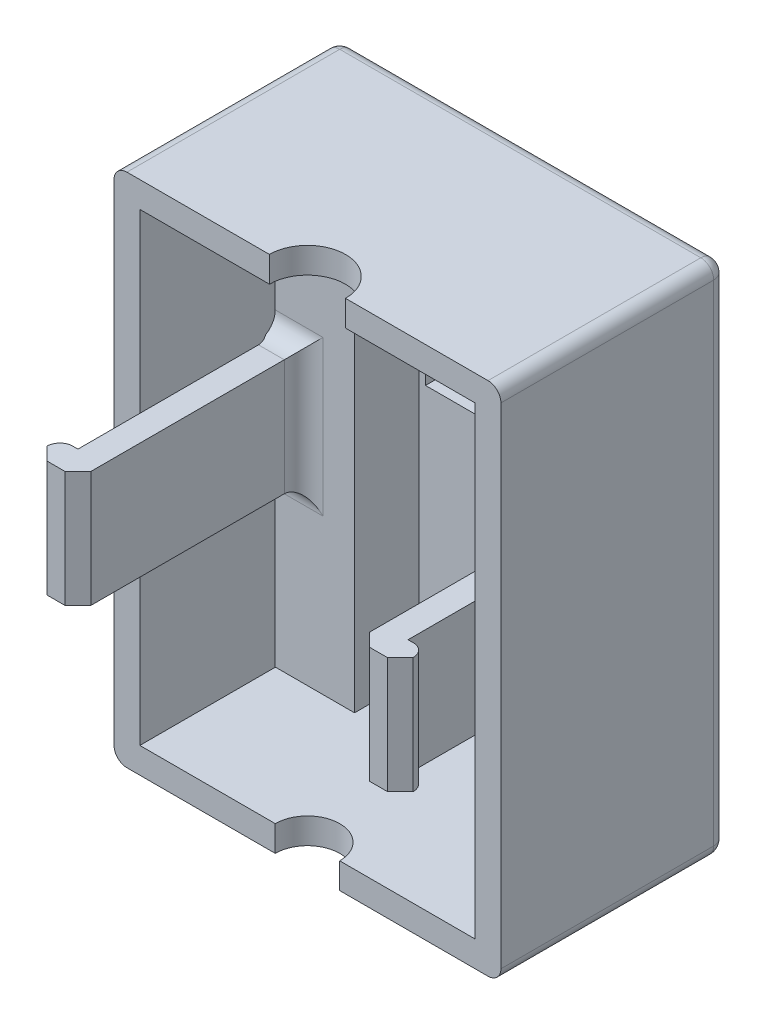
from build123d import *

# Parameters (mm, degrees)
SKETCH1_W           = 30
SKETCH1_H           = 40
BOSS_EXTRUDE1_DEPTH = 17.5
SKETCH2_W           = 26
SKETCH2_H           = 36
CUT_EXTRUDE1_DEPTH  = 15.5
SKETCH3_R           = 1.6
CUT_EXTRUDE2_DEPTH  = 30.41513216
BOSS_EXTRUDE2_DEPTH = 5
CUT_EXTRUDE3_DEPTH  = 45.443784717
CUT_EXTRUDE4_DEPTH  = 45.443784717
BOSS_EXTRUDE3_START = 0.2
SKETCH6_W           = 7
SKETCH6_H           = 9
SKETCH6_W_2         = 10.5
BOSS_EXTRUDE3_DEPTH = 2
FILLET2_R           = 1
BOSS_EXTRUDE7_START = 0.2
SKETCH7_W           = 17.5
SKETCH7_H           = 9
BOSS_EXTRUDE7_DEPTH = 2
SKETCH8_W           = 2
SKETCH8_H           = 9
BOSS_EXTRUDE8_DEPTH = 1.4
FILLET6_R           = 1.5
SKETCH9_W           = 2
SKETCH9_H           = 9
BOSS_EXTRUDE9_DEPTH = 1.4
CHAMFER1_SIZE       = 1
FILLET7_R           = 1


# Some blends are built 0.0001 mm under size
with BuildPart() as part:
    # Sketch1 → Boss-Extrude1 (new body)
    with BuildSketch(Plane.XY):
        Rectangle(SKETCH1_W, SKETCH1_H)
    extrude(amount=BOSS_EXTRUDE1_DEPTH)

    # Sketch2 → Cut-Extrude1 (cut)
    with BuildSketch(Plane.XY.offset(17.5)):
        Rectangle(SKETCH2_W, SKETCH2_H)
    extrude(amount=-CUT_EXTRUDE1_DEPTH, mode=Mode.SUBTRACT)

    # Sketch3 → Cut-Extrude2 (cut, through all)
    with BuildSketch(Plane.XY.offset(2)):
        Polygon((6.35, 1.75), (-6.35, 1.75), (-6.35, 15.75), (0, 15.75), (6.35, 15.75), align=None)
        with Locations((5.05, -6.6)):
            Circle(SKETCH3_R)
    extrude(amount=-CUT_EXTRUDE2_DEPTH, mode=Mode.SUBTRACT)

    # Sketch3<3> → Boss-Extrude2 (add)
    with BuildSketch(Plane.XY.offset(2)):
        Polygon((-6.85, -14), (-6.85, 18), (-13, 18), (-13, -17.985559901), (-6.85, -17.985559901), align=None)
        Polygon((13, 18), (6.85, 18), (6.85, -14), (6.85, -18), (13, -18), align=None)
    extrude(amount=BOSS_EXTRUDE2_DEPTH)

    # Sketch4 → Cut-Extrude3 (cut, through all)
    with BuildSketch(Plane.XZ.offset(-18)):
        with BuildLine():
            Line((-2.95, 17.5), (2.95, 17.5))
            ThreePointArc((2.95, 17.5), (0, 14.55), (-2.95, 17.5))
        make_face()
    extrude(amount=-CUT_EXTRUDE3_DEPTH, mode=Mode.SUBTRACT)

    # Sketch5 → Cut-Extrude4 (cut, through all)
    with BuildSketch(Plane(origin=(0, -18, 0), x_dir=(1, 0, 0), z_dir=(0, 1, 0))):
        with BuildLine():
            Line((-2.5, -17.5), (2.5, -17.5))
            ThreePointArc((2.5, -17.5), (0, -15), (-2.5, -17.5))
        make_face()
    extrude(amount=-CUT_EXTRUDE4_DEPTH, mode=Mode.SUBTRACT)

    # Sketch6 → Boss-Extrude3 (add)
    with BuildSketch(Plane.ZY.offset(-13).offset(BOSS_EXTRUDE3_START)):
        with Locations((21, 0)):
            Rectangle(SKETCH6_W, SKETCH6_H)
        with Locations((12.25, 0)):
            Rectangle(SKETCH6_W_2, SKETCH6_H)
    extrude(amount=BOSS_EXTRUDE3_DEPTH)

    # Fillet2
    fillet2_edges = [part.edges().sort_by_distance(p)[0] for p in [
        (0, -20, 0),
        (-15, 0, 0),
        (0, 20, 0),
        (15, 0, 0),
        (15, -20, 8.75),
        (-15, -20, 8.75),
        (-15, 20, 8.75),
        (15, 20, 8.75),
    ]]
    fillet(fillet2_edges, radius=FILLET2_R)

    # Sketch7 → Boss-Extrude7 (add)
    with BuildSketch(Plane(origin=(-13, 0, 0), x_dir=(0, 0, -1), z_dir=(1, 0, 0)).offset(BOSS_EXTRUDE7_START)):
        with Locations((-15.75, 0)):
            Rectangle(SKETCH7_W, SKETCH7_H)
    extrude(amount=BOSS_EXTRUDE7_DEPTH)

    # Sketch8 → Boss-Extrude8 (add)
    with BuildSketch(Plane.ZY.offset(12.8)):
        with Locations((23.5, 0)):
            Rectangle(SKETCH8_W, SKETCH8_H)
    extrude(amount=BOSS_EXTRUDE8_DEPTH)

    # Fillet6
    # the kernel refuses this fillet: 1.5 mm, written as the material it adds along each edge
    with BuildSketch(Plane(origin=(12.8, -4.5, 7), x_dir=(0, -1, 0), z_dir=(-1, 0, 0)), Plane(origin=(-12.8, 4.5, 7), x_dir=(0, 1, 0), z_dir=(1, 0, 0))) as fillet6_piece_1:
        with BuildLine():
            CenterArc((FILLET6_R, FILLET6_R), FILLET6_R, 180, 90)
            Line((0, FILLET6_R), (-FILLET6_R * 0.02, FILLET6_R))
            Line((-FILLET6_R * 0.02, FILLET6_R), (-FILLET6_R * 0.02, -FILLET6_R * 0.02))
            Line((-FILLET6_R * 0.02, -FILLET6_R * 0.02), (FILLET6_R, -FILLET6_R * 0.02))
            Line((FILLET6_R, -FILLET6_R * 0.02), (FILLET6_R, 0))
        make_face()
    extrude(amount=2)
    with BuildSketch(Plane(origin=(12.8, 4.5, 7), x_dir=(1, 0, 0), z_dir=(0, -1, 0)), Plane(origin=(-12.8, -4.5, 7), x_dir=(-1, 0, 0), z_dir=(0, 1, 0))) as fillet6_piece_2:
        with BuildLine():
            CenterArc((FILLET6_R, FILLET6_R), FILLET6_R, 180, 90)
            Line((0, FILLET6_R), (-FILLET6_R * 0.02, FILLET6_R))
            Line((-FILLET6_R * 0.02, FILLET6_R), (-FILLET6_R * 0.02, -FILLET6_R * 0.02))
            Line((-FILLET6_R * 0.02, -FILLET6_R * 0.02), (FILLET6_R, -FILLET6_R * 0.02))
            Line((FILLET6_R, -FILLET6_R * 0.02), (FILLET6_R, 0))
        make_face()
    extrude(amount=9)
    with BuildSketch(Plane(origin=(12.8, 4.5, 7), x_dir=(0, 1, 0), z_dir=(-1, 0, 0)), Plane(origin=(-12.8, -4.5, 7), x_dir=(0, -1, 0), z_dir=(1, 0, 0))) as fillet6_piece_3:
        with BuildLine():
            CenterArc((FILLET6_R, -FILLET6_R), FILLET6_R, 90, 90)
            Line((0, -FILLET6_R), (-FILLET6_R * 0.02, -FILLET6_R))
            Line((-FILLET6_R * 0.02, -FILLET6_R), (-FILLET6_R * 0.02, FILLET6_R * 0.02))
            Line((-FILLET6_R * 0.02, FILLET6_R * 0.02), (FILLET6_R, FILLET6_R * 0.02))
            Line((FILLET6_R, FILLET6_R * 0.02), (FILLET6_R, 0))
        make_face()
    extrude(amount=2)
    with BuildSketch(Plane(origin=(10.8, 4.5, 7), x_dir=(-1, 0, 0), z_dir=(0, -1, 0)), Plane(origin=(-10.8, -4.5, 7), x_dir=(1, 0, 0), z_dir=(0, 1, 0))) as fillet6_piece_4:
        with BuildLine():
            CenterArc((FILLET6_R, -FILLET6_R), FILLET6_R, 90, 90)
            Line((0, -FILLET6_R), (-FILLET6_R * 0.02, -FILLET6_R))
            Line((-FILLET6_R * 0.02, -FILLET6_R), (-FILLET6_R * 0.02, FILLET6_R * 0.02))
            Line((-FILLET6_R * 0.02, FILLET6_R * 0.02), (FILLET6_R, FILLET6_R * 0.02))
            Line((FILLET6_R, FILLET6_R * 0.02), (FILLET6_R, 0))
        make_face()
    extrude(amount=9)
    with BuildSketch(Plane(origin=(12.8, 4.5, 7), x_dir=(1, 0, 0), z_dir=(0, -1, 0))) as fillet6_piece_5a_section:
        with BuildLine():
            CenterArc((FILLET6_R, FILLET6_R), FILLET6_R, 180, 90)
            Line((0, FILLET6_R), (-FILLET6_R * 0.02, FILLET6_R))
            Line((-FILLET6_R * 0.02, FILLET6_R), (-FILLET6_R * 0.02, -FILLET6_R * 0.02))
            Line((-FILLET6_R * 0.02, -FILLET6_R * 0.02), (FILLET6_R, -FILLET6_R * 0.02))
            Line((FILLET6_R, -FILLET6_R * 0.02), (FILLET6_R, 0))
        make_face()
    fillet6_piece_5a = extrude(amount=12.75, mode=Mode.PRIVATE)
    fillet6_piece_5a = split(fillet6_piece_5a, bisect_by=Plane(origin=(13.139592671, -4.5, 7.339592671), z_dir=(0, -1, 0)), keep=Keep.TOP, mode=Mode.PRIVATE)
    with BuildSketch(Plane(origin=(16.55, -4.5, 7), x_dir=(0, -1, 0), z_dir=(-1, 0, 0))) as fillet6_piece_5b_section:
        with BuildLine():
            CenterArc((FILLET6_R, FILLET6_R), FILLET6_R, 180, 90)
            Line((0, FILLET6_R), (-FILLET6_R * 0.02, FILLET6_R))
            Line((-FILLET6_R * 0.02, FILLET6_R), (-FILLET6_R * 0.02, -FILLET6_R * 0.02))
            Line((-FILLET6_R * 0.02, -FILLET6_R * 0.02), (FILLET6_R, -FILLET6_R * 0.02))
            Line((FILLET6_R, -FILLET6_R * 0.02), (FILLET6_R, 0))
        make_face()
    fillet6_piece_5b = extrude(amount=5.75, mode=Mode.PRIVATE)
    fillet6_piece_5b = split(fillet6_piece_5b, bisect_by=Plane(origin=(12.8, -4.839592671, 7.339592671), z_dir=(1, 0, 0)), keep=Keep.TOP, mode=Mode.PRIVATE)
    fillet6_piece_5 = fillet6_piece_5a & fillet6_piece_5b
    add(fillet6_piece_5)
    with BuildSketch(Plane(origin=(10.8, 4.5, 7), x_dir=(-1, 0, 0), z_dir=(0, -1, 0))) as fillet6_piece_6a_section:
        with BuildLine():
            CenterArc((FILLET6_R, -FILLET6_R), FILLET6_R, 90, 90)
            Line((0, -FILLET6_R), (-FILLET6_R * 0.02, -FILLET6_R))
            Line((-FILLET6_R * 0.02, -FILLET6_R), (-FILLET6_R * 0.02, FILLET6_R * 0.02))
            Line((-FILLET6_R * 0.02, FILLET6_R * 0.02), (FILLET6_R, FILLET6_R * 0.02))
            Line((FILLET6_R, FILLET6_R * 0.02), (FILLET6_R, 0))
        make_face()
    fillet6_piece_6a = extrude(amount=12.75, mode=Mode.PRIVATE)
    fillet6_piece_6a = split(fillet6_piece_6a, bisect_by=Plane(origin=(10.460407329, -4.5, 7.339592671), z_dir=(0, -1, 0)), keep=Keep.TOP, mode=Mode.PRIVATE)
    with BuildSketch(Plane(origin=(12.8, -4.5, 7), x_dir=(0, -1, 0), z_dir=(-1, 0, 0))) as fillet6_piece_6b_section:
        with BuildLine():
            CenterArc((FILLET6_R, FILLET6_R), FILLET6_R, 180, 90)
            Line((0, FILLET6_R), (-FILLET6_R * 0.02, FILLET6_R))
            Line((-FILLET6_R * 0.02, FILLET6_R), (-FILLET6_R * 0.02, -FILLET6_R * 0.02))
            Line((-FILLET6_R * 0.02, -FILLET6_R * 0.02), (FILLET6_R, -FILLET6_R * 0.02))
            Line((FILLET6_R, -FILLET6_R * 0.02), (FILLET6_R, 0))
        make_face()
    fillet6_piece_6b = extrude(amount=5.75, mode=Mode.PRIVATE)
    fillet6_piece_6b = split(fillet6_piece_6b, bisect_by=Plane(origin=(10.8, -4.839592671, 7.339592671), z_dir=(-1, 0, 0)), keep=Keep.TOP, mode=Mode.PRIVATE)
    fillet6_piece_6 = fillet6_piece_6a & fillet6_piece_6b
    add(fillet6_piece_6)
    with BuildSketch(Plane(origin=(12.8, 8.25, 7), x_dir=(1, 0, 0), z_dir=(0, -1, 0))) as fillet6_piece_7a_section:
        with BuildLine():
            CenterArc((FILLET6_R, FILLET6_R), FILLET6_R, 180, 90)
            Line((0, FILLET6_R), (-FILLET6_R * 0.02, FILLET6_R))
            Line((-FILLET6_R * 0.02, FILLET6_R), (-FILLET6_R * 0.02, -FILLET6_R * 0.02))
            Line((-FILLET6_R * 0.02, -FILLET6_R * 0.02), (FILLET6_R, -FILLET6_R * 0.02))
            Line((FILLET6_R, -FILLET6_R * 0.02), (FILLET6_R, 0))
        make_face()
    fillet6_piece_7a = extrude(amount=12.75, mode=Mode.PRIVATE)
    fillet6_piece_7a = split(fillet6_piece_7a, bisect_by=Plane(origin=(13.139592671, 4.5, 7.339592671), z_dir=(0, 1, 0)), keep=Keep.TOP, mode=Mode.PRIVATE)
    with BuildSketch(Plane(origin=(16.55, 4.5, 7), x_dir=(0, 1, 0), z_dir=(-1, 0, 0))) as fillet6_piece_7b_section:
        with BuildLine():
            CenterArc((FILLET6_R, -FILLET6_R), FILLET6_R, 90, 90)
            Line((0, -FILLET6_R), (-FILLET6_R * 0.02, -FILLET6_R))
            Line((-FILLET6_R * 0.02, -FILLET6_R), (-FILLET6_R * 0.02, FILLET6_R * 0.02))
            Line((-FILLET6_R * 0.02, FILLET6_R * 0.02), (FILLET6_R, FILLET6_R * 0.02))
            Line((FILLET6_R, FILLET6_R * 0.02), (FILLET6_R, 0))
        make_face()
    fillet6_piece_7b = extrude(amount=5.75, mode=Mode.PRIVATE)
    fillet6_piece_7b = split(fillet6_piece_7b, bisect_by=Plane(origin=(12.8, 4.839592671, 7.339592671), z_dir=(1, 0, 0)), keep=Keep.TOP, mode=Mode.PRIVATE)
    fillet6_piece_7 = fillet6_piece_7a & fillet6_piece_7b
    add(fillet6_piece_7)
    with BuildSketch(Plane(origin=(12.8, 4.5, 7), x_dir=(0, 1, 0), z_dir=(-1, 0, 0))) as fillet6_piece_8a_section:
        with BuildLine():
            CenterArc((FILLET6_R, -FILLET6_R), FILLET6_R, 90, 90)
            Line((0, -FILLET6_R), (-FILLET6_R * 0.02, -FILLET6_R))
            Line((-FILLET6_R * 0.02, -FILLET6_R), (-FILLET6_R * 0.02, FILLET6_R * 0.02))
            Line((-FILLET6_R * 0.02, FILLET6_R * 0.02), (FILLET6_R, FILLET6_R * 0.02))
            Line((FILLET6_R, FILLET6_R * 0.02), (FILLET6_R, 0))
        make_face()
    fillet6_piece_8a = extrude(amount=5.75, mode=Mode.PRIVATE)
    fillet6_piece_8a = split(fillet6_piece_8a, bisect_by=Plane(origin=(10.8, 4.839592671, 7.339592671), z_dir=(-1, 0, 0)), keep=Keep.TOP, mode=Mode.PRIVATE)
    with BuildSketch(Plane(origin=(10.8, 8.25, 7), x_dir=(-1, 0, 0), z_dir=(0, -1, 0))) as fillet6_piece_8b_section:
        with BuildLine():
            CenterArc((FILLET6_R, -FILLET6_R), FILLET6_R, 90, 90)
            Line((0, -FILLET6_R), (-FILLET6_R * 0.02, -FILLET6_R))
            Line((-FILLET6_R * 0.02, -FILLET6_R), (-FILLET6_R * 0.02, FILLET6_R * 0.02))
            Line((-FILLET6_R * 0.02, FILLET6_R * 0.02), (FILLET6_R, FILLET6_R * 0.02))
            Line((FILLET6_R, FILLET6_R * 0.02), (FILLET6_R, 0))
        make_face()
    fillet6_piece_8b = extrude(amount=12.75, mode=Mode.PRIVATE)
    fillet6_piece_8b = split(fillet6_piece_8b, bisect_by=Plane(origin=(10.460407329, 4.5, 7.339592671), z_dir=(0, 1, 0)), keep=Keep.TOP, mode=Mode.PRIVATE)
    fillet6_piece_8 = fillet6_piece_8a & fillet6_piece_8b
    add(fillet6_piece_8)
    with BuildSketch(Plane(origin=(-16.55, 4.5, 7), x_dir=(0, 1, 0), z_dir=(1, 0, 0))) as fillet6_piece_9a_section:
        with BuildLine():
            CenterArc((FILLET6_R, FILLET6_R), FILLET6_R, 180, 90)
            Line((0, FILLET6_R), (-FILLET6_R * 0.02, FILLET6_R))
            Line((-FILLET6_R * 0.02, FILLET6_R), (-FILLET6_R * 0.02, -FILLET6_R * 0.02))
            Line((-FILLET6_R * 0.02, -FILLET6_R * 0.02), (FILLET6_R, -FILLET6_R * 0.02))
            Line((FILLET6_R, -FILLET6_R * 0.02), (FILLET6_R, 0))
        make_face()
    fillet6_piece_9a = extrude(amount=5.75, mode=Mode.PRIVATE)
    fillet6_piece_9a = split(fillet6_piece_9a, bisect_by=Plane(origin=(-12.8, 4.839592671, 7.339592671), z_dir=(-1, 0, 0)), keep=Keep.TOP, mode=Mode.PRIVATE)
    with BuildSketch(Plane(origin=(-12.8, -4.5, 7), x_dir=(-1, 0, 0), z_dir=(0, 1, 0))) as fillet6_piece_9b_section:
        with BuildLine():
            CenterArc((FILLET6_R, FILLET6_R), FILLET6_R, 180, 90)
            Line((0, FILLET6_R), (-FILLET6_R * 0.02, FILLET6_R))
            Line((-FILLET6_R * 0.02, FILLET6_R), (-FILLET6_R * 0.02, -FILLET6_R * 0.02))
            Line((-FILLET6_R * 0.02, -FILLET6_R * 0.02), (FILLET6_R, -FILLET6_R * 0.02))
            Line((FILLET6_R, -FILLET6_R * 0.02), (FILLET6_R, 0))
        make_face()
    fillet6_piece_9b = extrude(amount=12.75, mode=Mode.PRIVATE)
    fillet6_piece_9b = split(fillet6_piece_9b, bisect_by=Plane(origin=(-13.139592671, 4.5, 7.339592671), z_dir=(0, 1, 0)), keep=Keep.TOP, mode=Mode.PRIVATE)
    fillet6_piece_9 = fillet6_piece_9a & fillet6_piece_9b
    add(fillet6_piece_9)
    with BuildSketch(Plane(origin=(-10.8, -4.5, 7), x_dir=(1, 0, 0), z_dir=(0, 1, 0))) as fillet6_piece_10a_section:
        with BuildLine():
            CenterArc((FILLET6_R, -FILLET6_R), FILLET6_R, 90, 90)
            Line((0, -FILLET6_R), (-FILLET6_R * 0.02, -FILLET6_R))
            Line((-FILLET6_R * 0.02, -FILLET6_R), (-FILLET6_R * 0.02, FILLET6_R * 0.02))
            Line((-FILLET6_R * 0.02, FILLET6_R * 0.02), (FILLET6_R, FILLET6_R * 0.02))
            Line((FILLET6_R, FILLET6_R * 0.02), (FILLET6_R, 0))
        make_face()
    fillet6_piece_10a = extrude(amount=12.75, mode=Mode.PRIVATE)
    fillet6_piece_10a = split(fillet6_piece_10a, bisect_by=Plane(origin=(-10.460407329, 4.5, 7.339592671), z_dir=(0, 1, 0)), keep=Keep.TOP, mode=Mode.PRIVATE)
    with BuildSketch(Plane(origin=(-12.8, 4.5, 7), x_dir=(0, 1, 0), z_dir=(1, 0, 0))) as fillet6_piece_10b_section:
        with BuildLine():
            CenterArc((FILLET6_R, FILLET6_R), FILLET6_R, 180, 90)
            Line((0, FILLET6_R), (-FILLET6_R * 0.02, FILLET6_R))
            Line((-FILLET6_R * 0.02, FILLET6_R), (-FILLET6_R * 0.02, -FILLET6_R * 0.02))
            Line((-FILLET6_R * 0.02, -FILLET6_R * 0.02), (FILLET6_R, -FILLET6_R * 0.02))
            Line((FILLET6_R, -FILLET6_R * 0.02), (FILLET6_R, 0))
        make_face()
    fillet6_piece_10b = extrude(amount=5.75, mode=Mode.PRIVATE)
    fillet6_piece_10b = split(fillet6_piece_10b, bisect_by=Plane(origin=(-10.8, 4.839592671, 7.339592671), z_dir=(1, 0, 0)), keep=Keep.TOP, mode=Mode.PRIVATE)
    fillet6_piece_10 = fillet6_piece_10a & fillet6_piece_10b
    add(fillet6_piece_10)
    with BuildSketch(Plane(origin=(-16.55, -4.5, 7), x_dir=(0, -1, 0), z_dir=(1, 0, 0))) as fillet6_piece_11a_section:
        with BuildLine():
            CenterArc((FILLET6_R, -FILLET6_R), FILLET6_R, 90, 90)
            Line((0, -FILLET6_R), (-FILLET6_R * 0.02, -FILLET6_R))
            Line((-FILLET6_R * 0.02, -FILLET6_R), (-FILLET6_R * 0.02, FILLET6_R * 0.02))
            Line((-FILLET6_R * 0.02, FILLET6_R * 0.02), (FILLET6_R, FILLET6_R * 0.02))
            Line((FILLET6_R, FILLET6_R * 0.02), (FILLET6_R, 0))
        make_face()
    fillet6_piece_11a = extrude(amount=5.75, mode=Mode.PRIVATE)
    fillet6_piece_11a = split(fillet6_piece_11a, bisect_by=Plane(origin=(-12.8, -4.839592671, 7.339592671), z_dir=(-1, 0, 0)), keep=Keep.TOP, mode=Mode.PRIVATE)
    with BuildSketch(Plane(origin=(-12.8, -8.25, 7), x_dir=(-1, 0, 0), z_dir=(0, 1, 0))) as fillet6_piece_11b_section:
        with BuildLine():
            CenterArc((FILLET6_R, FILLET6_R), FILLET6_R, 180, 90)
            Line((0, FILLET6_R), (-FILLET6_R * 0.02, FILLET6_R))
            Line((-FILLET6_R * 0.02, FILLET6_R), (-FILLET6_R * 0.02, -FILLET6_R * 0.02))
            Line((-FILLET6_R * 0.02, -FILLET6_R * 0.02), (FILLET6_R, -FILLET6_R * 0.02))
            Line((FILLET6_R, -FILLET6_R * 0.02), (FILLET6_R, 0))
        make_face()
    fillet6_piece_11b = extrude(amount=12.75, mode=Mode.PRIVATE)
    fillet6_piece_11b = split(fillet6_piece_11b, bisect_by=Plane(origin=(-13.139592671, -4.5, 7.339592671), z_dir=(0, -1, 0)), keep=Keep.TOP, mode=Mode.PRIVATE)
    fillet6_piece_11 = fillet6_piece_11a & fillet6_piece_11b
    add(fillet6_piece_11)
    with BuildSketch(Plane(origin=(-12.8, -4.5, 7), x_dir=(0, -1, 0), z_dir=(1, 0, 0))) as fillet6_piece_12a_section:
        with BuildLine():
            CenterArc((FILLET6_R, -FILLET6_R), FILLET6_R, 90, 90)
            Line((0, -FILLET6_R), (-FILLET6_R * 0.02, -FILLET6_R))
            Line((-FILLET6_R * 0.02, -FILLET6_R), (-FILLET6_R * 0.02, FILLET6_R * 0.02))
            Line((-FILLET6_R * 0.02, FILLET6_R * 0.02), (FILLET6_R, FILLET6_R * 0.02))
            Line((FILLET6_R, FILLET6_R * 0.02), (FILLET6_R, 0))
        make_face()
    fillet6_piece_12a = extrude(amount=5.75, mode=Mode.PRIVATE)
    fillet6_piece_12a = split(fillet6_piece_12a, bisect_by=Plane(origin=(-10.8, -4.839592671, 7.339592671), z_dir=(1, 0, 0)), keep=Keep.TOP, mode=Mode.PRIVATE)
    with BuildSketch(Plane(origin=(-10.8, -8.25, 7), x_dir=(1, 0, 0), z_dir=(0, 1, 0))) as fillet6_piece_12b_section:
        with BuildLine():
            CenterArc((FILLET6_R, -FILLET6_R), FILLET6_R, 90, 90)
            Line((0, -FILLET6_R), (-FILLET6_R * 0.02, -FILLET6_R))
            Line((-FILLET6_R * 0.02, -FILLET6_R), (-FILLET6_R * 0.02, FILLET6_R * 0.02))
            Line((-FILLET6_R * 0.02, FILLET6_R * 0.02), (FILLET6_R, FILLET6_R * 0.02))
            Line((FILLET6_R, FILLET6_R * 0.02), (FILLET6_R, 0))
        make_face()
    fillet6_piece_12b = extrude(amount=12.75, mode=Mode.PRIVATE)
    fillet6_piece_12b = split(fillet6_piece_12b, bisect_by=Plane(origin=(-10.460407329, -4.5, 7.339592671), z_dir=(0, -1, 0)), keep=Keep.TOP, mode=Mode.PRIVATE)
    fillet6_piece_12 = fillet6_piece_12a & fillet6_piece_12b
    add(fillet6_piece_12)

    # Sketch9 → Boss-Extrude9 (add)
    with BuildSketch(Plane(origin=(12.8, 0, 0), x_dir=(0, 0, -1), z_dir=(1, 0, 0))):
        with Locations((-23.5, 0)):
            Rectangle(SKETCH9_W, SKETCH9_H)
    extrude(amount=BOSS_EXTRUDE9_DEPTH)

    # Chamfer1
    chamfer1_edges = [part.edges().sort_by_distance(p)[0] for p in [
        (10.8, 0, 24.5),
        (-10.8, 0, 24.5),
        (-14.2, 0, 24.5),
        (14.2, 0, 24.5),
    ]]
    chamfer(chamfer1_edges, length=CHAMFER1_SIZE)

    # Fillet7
    fillet7_edges = [part.edges().sort_by_distance(p)[0] for p in [
        (-14.2, 0, 22.5),
        (14.2, 0, 22.5),
    ]]
    fillet(fillet7_edges, radius=FILLET7_R - 0.0001)  # a hair under: the kernel refuses the full size


solid = part.part
